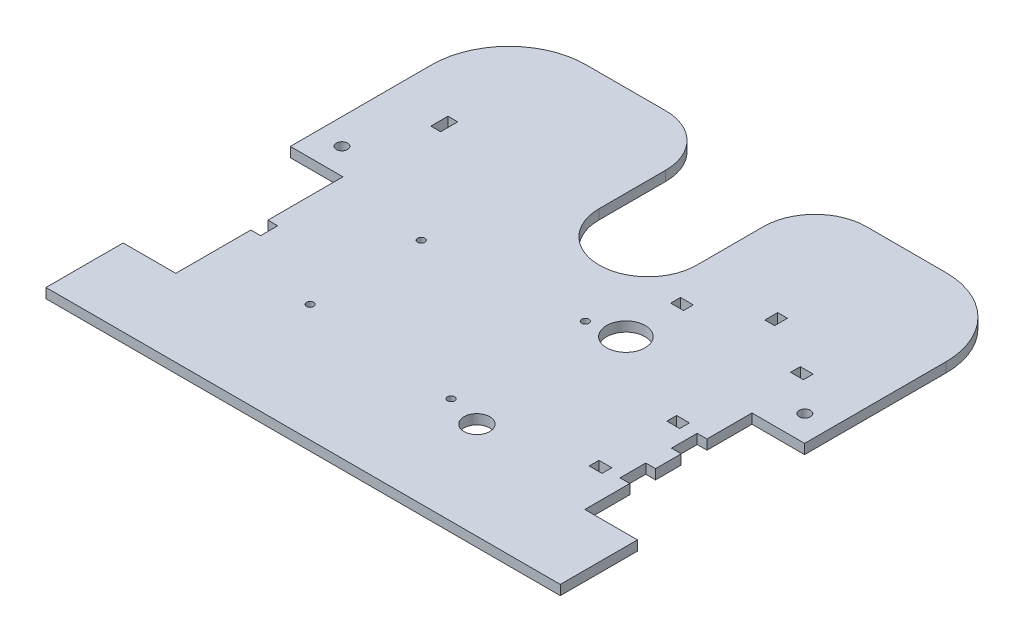
from build123d import *

# Parameters (mm, degrees)
SKETCH1_W           = 254
SKETCH1_H           = 228.6
BOSS_EXTRUDE1_DEPTH = 4.826
SKETCH2_W           = 26.00000007
SKETCH2_H           = 82.55
CUT_EXTRUDE1_DEPTH  = 4.826
CUT_EXTRUDE3_DEPTH  = 4.826
SKETCH17_R          = 2.778125
CUT_EXTRUDE14_DEPTH = 171.929167423
SKETCH18_W          = 4.826
SKETCH18_H          = 12.7
CUT_EXTRUDE15_DEPTH = 171.929167423
SKETCH19_W          = 4.826
SKETCH19_H          = 8.466666666
CUT_EXTRUDE16_DEPTH = 171.929167423
SKETCH20_W          = 6.35
SKETCH20_H          = 4.826
CUT_EXTRUDE17_DEPTH = 4.826
SKETCH21_R          = 1.778
CUT_EXTRUDE18_DEPTH = 171.929167423
SKETCH22_R          = 6.35
CUT_EXTRUDE19_DEPTH = 171.929167423
SKETCH24_R          = 24.13
CUT_EXTRUDE21_DEPTH = 171.929167423
SKETCH26_W          = 6.35
SKETCH26_H          = 4.826
SKETCH26_W_2        = 4.826
SKETCH26_H_2        = 6.35
CUT_EXTRUDE23_DEPTH = 171.929167423
CUT_EXTRUDE25_DEPTH = 171.929167423
FILLET1_R           = 25.4
SKETCH29_R          = 9.525
CUT_EXTRUDE26_DEPTH = 171.929167423


with BuildPart() as part:
    # Sketch1 → Boss-Extrude1 (new body)
    with BuildSketch(Plane(origin=(0, 0, 0), x_dir=(1, 0, 0), z_dir=(0, 1, 0))):
        Rectangle(SKETCH1_W, SKETCH1_H)
    extrude(amount=BOSS_EXTRUDE1_DEPTH)

    # Sketch2 → Cut-Extrude1 (cut)
    with BuildSketch(Plane(origin=(0, 4.826, 0), x_dir=(1, 0, 0), z_dir=(0, 1, 0))):
        with Locations((-113.999999965, -34.925)):
            Rectangle(SKETCH2_W, SKETCH2_H)
        with Locations((113.999999965, -34.925)):
            Rectangle(SKETCH2_W, SKETCH2_H)
    extrude(amount=-CUT_EXTRUDE1_DEPTH, mode=Mode.SUBTRACT)

    # Sketch4 → Cut-Extrude3 (cut)
    with BuildSketch(Plane(origin=(0, 4.826, 0), x_dir=(1, 0, 0), z_dir=(0, 1, 0))):
        with BuildLine():
            Line((-127, 76.2), (-127, 114.3))
            Line((-127, 114.3), (-88.9, 114.3))
            ThreePointArc((-88.9, 114.3), (-115.840768363, 103.140768363), (-127, 76.2))
        make_face()
        with BuildLine():
            Line((127, 76.2), (127, 114.3))
            Line((127, 114.3), (88.9, 114.3))
            ThreePointArc((88.9, 114.3), (115.840768363, 103.140768363), (127, 76.2))
        make_face()
    extrude(amount=-CUT_EXTRUDE3_DEPTH, mode=Mode.SUBTRACT)

    # Sketch17 → Cut-Extrude14 (cut, through all)
    with BuildSketch(Plane.XZ):
        with Locations((114.3, -19.164632523)):
            Circle(SKETCH17_R)
        with Locations((-114.3, -19.164632523)):
            Circle(SKETCH17_R)
    extrude(amount=-CUT_EXTRUDE14_DEPTH, mode=Mode.SUBTRACT)

    # Sketch18 → Cut-Extrude15 (cut, through all)
    with BuildSketch(Plane(origin=(0, 4.826, 0), x_dir=(1, 0, 0), z_dir=(0, 1, 0))):
        with Locations((98.58699993, -47.625)):
            Rectangle(SKETCH18_W, SKETCH18_H)
        with Locations((98.58699993, -22.225)):
            Rectangle(SKETCH18_W, SKETCH18_H)
    extrude(amount=-CUT_EXTRUDE15_DEPTH, mode=Mode.SUBTRACT)

    # Sketch19 → Cut-Extrude16 (cut, through all)
    with BuildSketch(Plane(origin=(0, 4.826, 0), x_dir=(1, 0, 0), z_dir=(0, 1, 0))):
        with Locations((-98.58699993, -34.925)):
            Rectangle(SKETCH19_W, SKETCH19_H)
        with Locations((-98.58699993, 53.975)):
            Rectangle(SKETCH19_W, SKETCH19_H)
    extrude(amount=-CUT_EXTRUDE16_DEPTH, mode=Mode.SUBTRACT)

    # Sketch20 → Cut-Extrude17 (cut)
    with BuildSketch(Plane.XZ):
        with Locations((86.64899993, 54.102)):
            Rectangle(SKETCH20_W, SKETCH20_H)
        with Locations((86.64899993, 15.748)):
            Rectangle(SKETCH20_W, SKETCH20_H)
    extrude(amount=-CUT_EXTRUDE17_DEPTH, mode=Mode.SUBTRACT)

    # Sketch21 → Cut-Extrude18 (cut, through all)
    with BuildSketch(Plane(origin=(0, 4.826, 0), x_dir=(1, 0, 0), z_dir=(0, 1, 0))):
        with Locations((-54.548927696, -56.293994427)):
            Circle(SKETCH21_R)
        with Locations((-54.548927696, -1.429994427)):
            Circle(SKETCH21_R)
        with Locations((20.635072304, -61.881994427)):
            Circle(SKETCH21_R)
        with Locations((20.635072304, 4.412005573)):
            Circle(SKETCH21_R)
    extrude(amount=-CUT_EXTRUDE18_DEPTH, mode=Mode.SUBTRACT)

    # Sketch22 → Cut-Extrude19 (cut, through all)
    with BuildSketch(Plane(origin=(0, 4.826, 0), x_dir=(1, 0, 0), z_dir=(0, 1, 0))):
        with Locations((37.84899924, -66.33273812)):
            Circle(SKETCH22_R)
    extrude(amount=-CUT_EXTRUDE19_DEPTH, mode=Mode.SUBTRACT)

    # Sketch24 → Cut-Extrude21 (cut, through all)
    with BuildSketch(Plane.XZ):
        with Locations((0, -55.982011538)):
            Circle(SKETCH24_R)
    extrude(amount=-CUT_EXTRUDE21_DEPTH, mode=Mode.SUBTRACT)

    # Sketch26 → Cut-Extrude23 (cut, through all)
    with BuildSketch(Plane(origin=(0, 4.826, 0), x_dir=(1, 0, 0), z_dir=(0, 1, 0))):
        with Locations((96.30099993, 35.687)):
            Rectangle(SKETCH26_W, SKETCH26_H)
        with Locations((66.83699993, 52.451)):
            Rectangle(SKETCH26_W_2, SKETCH26_H_2)
        with Locations((37.11899993, 35.687)):
            Rectangle(SKETCH26_W, SKETCH26_H)
    extrude(amount=-CUT_EXTRUDE23_DEPTH, mode=Mode.SUBTRACT)

    # Sketch28 → Cut-Extrude25 (cut, through all)
    with BuildSketch(Plane(origin=(0, 4.826, 0), x_dir=(1, 0, 0), z_dir=(0, 1, 0))):
        with BuildLine():
            Line((-24.13, 114.3), (-24.13, 55.982011538))
            ThreePointArc((-24.13, 55.982011538), (0, 80.112011538), (24.13, 55.982011538))
            Line((24.13, 55.982011538), (24.13, 114.3))
            Line((24.13, 114.3), (-24.13, 114.3))
        make_face()
    extrude(amount=-CUT_EXTRUDE25_DEPTH, mode=Mode.SUBTRACT)

    # Fillet1
    fillet1_edges = [part.edges().sort_by_distance(p)[0] for p in [
        (-24.13, 2.413, -114.3),
        (24.13, 2.413, -114.3),
    ]]
    fillet(fillet1_edges, radius=FILLET1_R)

    # Sketch29 → Cut-Extrude26 (cut, through all)
    with BuildSketch(Plane(origin=(0, 4.826, 0), x_dir=(1, 0, 0), z_dir=(0, 1, 0))):
        with Locations((37.217780155, 7.874)):
            Circle(SKETCH29_R)
    extrude(amount=-CUT_EXTRUDE26_DEPTH, mode=Mode.SUBTRACT)


solid = part.part
